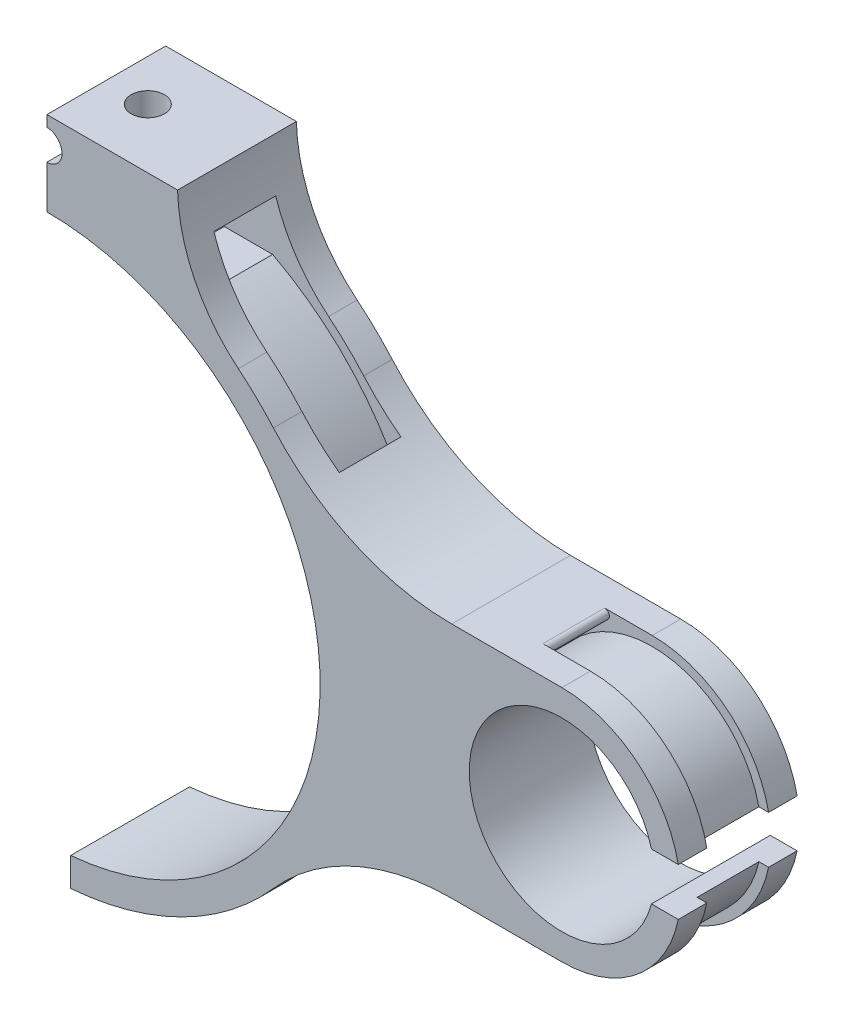
from build123d import *
from build123d.topology import SkipClean

# Parameters (mm, degrees)
SKETCH1_R                        = 63.5
SKETCH1_R_2                      = 57.5
MAIN_SHAPE_DEPTH                 = 12.5
MOTOR_MOUNT_REACH                = 92.668
MOTOR_MOUNT_DIRECTION_2_REACH    = 92.668
HARNESS_START                    = -12.5
HARNESS_DEPTH                    = 25
HARNESS_FILLET_R                 = 35
SKETCH3_R                        = 65.5
SKETCH3_R_2                      = 61.5
MAIN_SLOT_DEPTH                  = 6.5
SKETCH8_R                        = 19.5
MOTOR_CUT_DEPTH                  = 154.6383962
SKETCH9_R                        = 25
SKETCH9_R_2                      = 23
MOTOR_SLOT_DEPTH                 = 6.5
MOTOR_MOUNT_FILLET_R             = 50
SKETCH17_W                       = 6.80384635
SKETCH17_H                       = 10
MOTOR_KEYWAY_DEPTH               = 156.156394606
MOTOR_MOUNT_FILLET_OF_MIRROR_2_R = 50
BOLT_HOLES_REACH                 = 194.503
BOLT_HOLES_END_RADIUS            = 65.5
SKETCH13_R                       = 3.5
SKETCH15_W                       = 10
SKETCH15_H                       = 25
MAIN_KEYWAY_DEPTH                = 154.200127936
HARNESS_CUT_DEPTH                = 154.200127936
HARNESS_CUT_DEPTH_BACK           = 154.200127936
SKETCH19_W                       = 13
SKETCH19_H                       = 11
SKETCH22_R                       = 3.175
CUT_EXTRUDE1_DEPTH               = 155.72242625
FILLET1_START                    = -6.5
FILLET1_DEPTH                    = 13
SKETCH18_W                       = 87.910822745
SKETCH18_H                       = 167.162250969
SPLIT_FOR_PRINTING_DEPTH         = 154.200127887


with BuildPart() as part:
    # Sketch1 → main shape (new, symmetric)
    with BuildSketch(Plane.XY):
        Circle(SKETCH1_R)
        Circle(SKETCH1_R_2, mode=Mode.SUBTRACT)
    extrude(amount=MAIN_SHAPE_DEPTH, both=True)

    # motor mount: up to this face of the body (flat: up to its plane)
    motor_mount_end = Plane(part.part.faces().sort_by_distance((-61.703948776, 0, 12.5))[0])
    # Sketch6 → motor mount (add, up to the picked face)
    with BuildSketch(Plane.XY, mode=Mode.PRIVATE) as motor_mount_sk1:
        with BuildLine():
            Line((-58.37165408, 25), (-108.37165408, 25))
            ThreePointArc((-108.37165408, 25), (-133.37165408, 0), (-108.37165408, -25))
            Line((-108.37165408, -25), (-58.37165408, -25))
            ThreePointArc((-58.37165408, -25), (-63.5, 0), (-58.37165408, 25))
        make_face()
    motor_mount_tool1 = split(extrude(motor_mount_sk1.sketch, amount=MOTOR_MOUNT_REACH, mode=Mode.PRIVATE), bisect_by=motor_mount_end, keep=Keep.BOTH, mode=Mode.PRIVATE)
    motor_mount = motor_mount_tool1.solids().sort_by(Axis((-95.130644, 0, 0), (0, 0, 1)))[0]
    add(motor_mount)

    # motor mount direction 2: up to this face of the body (flat: up to its plane)
    motor_mount_direction_2_end = Plane(part.part.faces().sort_by_distance((-61.703948776, 0, -12.5))[0])
    # Sketch6 → motor mount direction 2 (add, up to the picked face)
    with BuildSketch(Plane.XY, mode=Mode.PRIVATE) as motor_mount_direction_2_sk1:
        with BuildLine():
            Line((-58.37165408, 25), (-108.37165408, 25))
            ThreePointArc((-108.37165408, 25), (-133.37165408, 0), (-108.37165408, -25))
            Line((-108.37165408, -25), (-58.37165408, -25))
            ThreePointArc((-58.37165408, -25), (-63.5, 0), (-58.37165408, 25))
        make_face()
    motor_mount_direction_2_tool1 = split(extrude(motor_mount_direction_2_sk1.sketch, amount=-MOTOR_MOUNT_DIRECTION_2_REACH, mode=Mode.PRIVATE), bisect_by=motor_mount_direction_2_end, keep=Keep.BOTH, mode=Mode.PRIVATE)
    motor_mount_direction_2 = motor_mount_direction_2_tool1.solids().sort_by(Axis((-95.130644, 0, 0), (0, 0, -1)))[0]
    add(motor_mount_direction_2)

    # Sketch11 → harness (add)
    with BuildSketch(Plane.XY.offset(HARNESS_START)):
        with BuildLine():
            Line((27.5, 75.236352085), (27.5, 57.236352085))
            ThreePointArc((27.5, 57.236352085), (0, 63.5), (-27.5, 57.236352085))
            Line((-27.5, 57.236352085), (-27.5, 75.236352085))
            Line((-27.5, 75.236352085), (27.5, 75.236352085))
        make_face()
    extrude(amount=HARNESS_DEPTH)

    # harness fillet
    # the kernel refuses this fillet: 35 mm, written as the material it adds along each edge
    with BuildSketch(Plane(origin=(27.5, 57.236352085, -12.5), x_dir=(0.8432130840370694, -0.5375794777599814, 0), z_dir=(0, 0, 1))) as harness_fillet_piece_1:
        with BuildLine():
            CenterArc((19.339811168, 34.749695763), HARNESS_FILLET_R, 214.0002145, 49.143374048)
            Line((-9.6764306, 15.177835513), (-10.256755435, 14.786398308))
            ThreePointArc((-10.256755435, 14.786398308), (-5.428464459, 7.212612122), (-0.590249159, -0.376305634))
            Line((-0.590249159, -0.376305634), (0.083567085, -0.694993915))
            ThreePointArc((0.083567085, -0.694993915), (7.580728452, -0.245876599), (15.077889818, -0.694993915))
            Line((15.077889818, -0.694993915), (15.161456903, 0))
        make_face()
    extrude(amount=25)
    with BuildSketch(Plane(origin=(-27.5, 57.236352085, -12.5), x_dir=(-0.8432130840370696, -0.5375794777599807, 0), z_dir=(0, 0, 1))) as harness_fillet_piece_2:
        with BuildLine():
            CenterArc((19.339811168, -34.749695763), HARNESS_FILLET_R, 96.856411452, 49.143374048)
            Line((-9.6764306, -15.177835513), (-10.256755435, -14.786398308))
            ThreePointArc((-10.256755435, -14.786398308), (-5.428464459, -7.212612122), (-0.590249159, 0.376305634))
            Line((-0.590249159, 0.376305634), (0.083567085, 0.694993915))
            ThreePointArc((0.083567085, 0.694993915), (7.580728452, 0.245876599), (15.077889818, 0.694993915))
            Line((15.077889818, 0.694993915), (15.161456903, 0))
        make_face()
    extrude(amount=25)

    # Sketch3 → main slot (cut, symmetric)
    with BuildSketch(Plane.XY):
        Circle(SKETCH3_R)
        Circle(SKETCH3_R_2, mode=Mode.SUBTRACT)
    main_slot = extrude(amount=MAIN_SLOT_DEPTH, both=True, mode=Mode.SUBTRACT)

    # Sketch8 → motor cut (cut, symmetric)
    with BuildSketch(Plane.XY):
        with Locations((-108.37165408, 0)):
            Circle(SKETCH8_R)
    motor_cut = extrude(amount=MOTOR_CUT_DEPTH, both=True, mode=Mode.SUBTRACT)

    # Sketch9 → motor slot (cut, symmetric)
    with BuildSketch(Plane.XY):
        with Locations((-108.37165408, 0)):
            Circle(SKETCH9_R)
        with Locations((-108.37165408, 0)):
            Circle(SKETCH9_R_2, mode=Mode.SUBTRACT)
    motor_slot = extrude(amount=MOTOR_SLOT_DEPTH, both=True, mode=Mode.SUBTRACT)

    # motor mount fillet
    # the kernel refuses this fillet: 50 mm, written as the material it adds along each edge
    with BuildSketch(Plane(origin=(-58.37165408, 25, -12.5), x_dir=(0.5339491439674308, 0.845516594548237, 0), z_dir=(0, 0, 1))) as motor_mount_fillet_piece_1_section:
        with BuildLine():
            CenterArc((27.956466708, 49.372386437), MOTOR_MOUNT_FILLET_R, 212.272672979, 48.639624147)
            Line((-14.31936302, 22.674929238), (0, 0))
            ThreePointArc((0, 0), (10.029579864, 0.797069225), (20.059159728, 0))
        make_face()
    motor_mount_fillet_piece_1 = extrude(amount=6, mode=Mode.PRIVATE)
    motor_mount_fillet_piece_1 = motor_mount_fillet_piece_1 & Plane(origin=(0, 0, -12.5), x_dir=(1, 0, 0), z_dir=(0, 0, 1)) * Cylinder(65.5, 103, mode=Mode.PRIVATE)
    add(motor_mount_fillet_piece_1)
    with BuildSketch(Plane(origin=(-58.37165408, 25, -12.5), x_dir=(0.5339491439674308, 0.845516594548237, 0), z_dir=(0, 0, 1))) as motor_mount_fillet_piece_2_section:
        with BuildLine():
            CenterArc((27.956466708, 49.372386437), MOTOR_MOUNT_FILLET_R, 212.272672979, 48.639624147)
            Line((-14.31936302, 22.674929238), (0, 0))
            ThreePointArc((0, 0), (10.029579864, 0.797069225), (20.059159728, 0))
        make_face()
    motor_mount_fillet_piece_2 = extrude(amount=6, mode=Mode.PRIVATE)
    motor_mount_fillet_piece_2 = motor_mount_fillet_piece_2 - Plane(origin=(0, 0, -12.5), x_dir=(1, 0, 0), z_dir=(0, 0, 1)) * Cylinder(65.5, 103, mode=Mode.PRIVATE)
    add(motor_mount_fillet_piece_2)
    with BuildSketch(Plane(origin=(-58.37165408, 25, -12.5), x_dir=(0.5339491439674308, 0.845516594548237, 0), z_dir=(0, 0, 1))) as motor_mount_fillet_piece_3_section:
        with BuildLine():
            CenterArc((27.956466708, 49.372386437), MOTOR_MOUNT_FILLET_R, 212.272672979, 48.639624147)
            Line((-14.31936302, 22.674929238), (0, 0))
            ThreePointArc((0, 0), (10.029579864, 0.797069225), (20.059159728, 0))
        make_face()
    motor_mount_fillet_piece_3 = extrude(amount=73.044601445, mode=Mode.PRIVATE)
    motor_mount_fillet_piece_3 = split(motor_mount_fillet_piece_3, bisect_by=Plane(origin=(-58.37165408, 25, -6.5), z_dir=(0, 0, 1)), keep=Keep.TOP, mode=Mode.PRIVATE)
    motor_mount_fillet_piece_3 = split(motor_mount_fillet_piece_3, bisect_by=Plane(origin=(-58.37165408, 25, 6.5), z_dir=(0, 0, -1)), keep=Keep.TOP, mode=Mode.PRIVATE)
    motor_mount_fillet_piece_3 = motor_mount_fillet_piece_3 - Plane(origin=(0, 0, -12.5), x_dir=(1, 0, 0), z_dir=(0, 0, 1)) * Cylinder(65.5, 237, mode=Mode.PRIVATE)
    add(motor_mount_fillet_piece_3)
    with BuildSketch(Plane(origin=(-58.37165408, 25, -12.5), x_dir=(0.5339491439674308, 0.845516594548237, 0), z_dir=(0, 0, 1))) as motor_mount_fillet_piece_4_section:
        with BuildLine():
            CenterArc((27.956466708, 49.372386437), MOTOR_MOUNT_FILLET_R, 212.272672979, 48.639624147)
            Line((-14.31936302, 22.674929238), (0, 0))
            ThreePointArc((0, 0), (10.029579864, 0.797069225), (20.059159728, 0))
        make_face()
    motor_mount_fillet_piece_4 = extrude(amount=73.044601445, mode=Mode.PRIVATE)
    motor_mount_fillet_piece_4 = split(motor_mount_fillet_piece_4, bisect_by=Plane(origin=(-58.37165408, 25, 12.5), z_dir=(0, 0, -1)), keep=Keep.TOP, mode=Mode.PRIVATE)
    motor_mount_fillet_piece_4 = split(motor_mount_fillet_piece_4, bisect_by=Plane(origin=(-58.37165408, 25, 6.5), z_dir=(0, 0, 1)), keep=Keep.TOP, mode=Mode.PRIVATE)
    motor_mount_fillet_piece_4 = motor_mount_fillet_piece_4 & Plane(origin=(0, 0, -12.5), x_dir=(1, 0, 0), z_dir=(0, 0, 1)) * Cylinder(65.5, 237, mode=Mode.PRIVATE)
    add(motor_mount_fillet_piece_4)
    with BuildSketch(Plane(origin=(-58.37165408, 25, -12.5), x_dir=(0.5339491439674308, 0.845516594548237, 0), z_dir=(0, 0, 1))) as motor_mount_fillet_piece_5_section:
        with BuildLine():
            CenterArc((27.956466708, 49.372386437), MOTOR_MOUNT_FILLET_R, 212.272672979, 48.639624147)
            Line((-14.31936302, 22.674929238), (0, 0))
            ThreePointArc((0, 0), (10.029579864, 0.797069225), (20.059159728, 0))
        make_face()
    motor_mount_fillet_piece_5 = extrude(amount=73.044601445, mode=Mode.PRIVATE)
    motor_mount_fillet_piece_5 = split(motor_mount_fillet_piece_5, bisect_by=Plane(origin=(-58.37165408, 25, 12.5), z_dir=(0, 0, -1)), keep=Keep.TOP, mode=Mode.PRIVATE)
    motor_mount_fillet_piece_5 = split(motor_mount_fillet_piece_5, bisect_by=Plane(origin=(-58.37165408, 25, 6.5), z_dir=(0, 0, 1)), keep=Keep.TOP, mode=Mode.PRIVATE)
    motor_mount_fillet_piece_5 = motor_mount_fillet_piece_5 - Plane(origin=(0, 0, -12.5), x_dir=(1, 0, 0), z_dir=(0, 0, 1)) * Cylinder(65.5, 237, mode=Mode.PRIVATE)
    add(motor_mount_fillet_piece_5)
    with BuildSketch(Plane(origin=(-58.37165408, -25, 12.5), x_dir=(-1, 0, 0), z_dir=(0, 0, -1))) as motor_mount_fillet_piece_6_section:
        with BuildLine():
            CenterArc((26.817840578, -50), MOTOR_MOUNT_FILLET_R, 90, 48.639624147)
            ThreePointArc((-10.710571166, -16.960352423), (-4.681350326, -8.905770642), (0, 0))
            Line((0, 0), (26.817840578, 0))
        make_face()
    motor_mount_fillet_piece_6 = extrude(amount=6, mode=Mode.PRIVATE)
    motor_mount_fillet_piece_6 = motor_mount_fillet_piece_6 - Plane(origin=(0, 0, 12.5), x_dir=(1, 0, 0), z_dir=(0, 0, 1)) * Cylinder(65.5, 120, mode=Mode.PRIVATE)
    add(motor_mount_fillet_piece_6)
    with BuildSketch(Plane(origin=(-58.37165408, -25, 12.5), x_dir=(-1, 0, 0), z_dir=(0, 0, -1))) as motor_mount_fillet_piece_7_section:
        with BuildLine():
            CenterArc((26.817840578, -50), MOTOR_MOUNT_FILLET_R, 90, 48.639624147)
            ThreePointArc((-10.710571166, -16.960352423), (-4.681350326, -8.905770642), (0, 0))
            Line((0, 0), (26.817840578, 0))
        make_face()
    motor_mount_fillet_piece_7 = extrude(amount=6, mode=Mode.PRIVATE)
    motor_mount_fillet_piece_7 = motor_mount_fillet_piece_7 & Plane(origin=(0, 0, 12.5), x_dir=(1, 0, 0), z_dir=(0, 0, 1)) * Cylinder(65.5, 120, mode=Mode.PRIVATE)
    add(motor_mount_fillet_piece_7)
    with BuildSketch(Plane(origin=(-58.37165408, -25, 12.5), x_dir=(-1, 0, 0), z_dir=(0, 0, -1))) as motor_mount_fillet_piece_8_section:
        with BuildLine():
            CenterArc((26.817840578, -50), MOTOR_MOUNT_FILLET_R, 90, 48.639624147)
            ThreePointArc((-10.710571166, -16.960352423), (-4.681350326, -8.905770642), (0, 0))
            Line((0, 0), (26.817840578, 0))
        make_face()
    motor_mount_fillet_piece_8 = extrude(amount=73.044601445, mode=Mode.PRIVATE)
    motor_mount_fillet_piece_8 = split(motor_mount_fillet_piece_8, bisect_by=Plane(origin=(-58.37165408, -25, 6.5), z_dir=(0, 0, -1)), keep=Keep.TOP, mode=Mode.PRIVATE)
    motor_mount_fillet_piece_8 = motor_mount_fillet_piece_8 - Plane(origin=(0, 0, 12.5), x_dir=(1, 0, 0), z_dir=(0, 0, 1)) * Cylinder(65.5, 254, mode=Mode.PRIVATE)
    motor_mount_fillet_piece_8 = split(motor_mount_fillet_piece_8, bisect_by=Plane(origin=(-58.37165408, -25, -6.5), z_dir=(0, 0, 1)), keep=Keep.TOP, mode=Mode.PRIVATE)
    add(motor_mount_fillet_piece_8)
    with BuildSketch(Plane(origin=(-58.37165408, -25, 12.5), x_dir=(-1, 0, 0), z_dir=(0, 0, -1))) as motor_mount_fillet_piece_9_section:
        with BuildLine():
            CenterArc((26.817840578, -50), MOTOR_MOUNT_FILLET_R, 90, 48.639624147)
            ThreePointArc((-10.710571166, -16.960352423), (-4.681350326, -8.905770642), (0, 0))
            Line((0, 0), (26.817840578, 0))
        make_face()
    motor_mount_fillet_piece_9 = extrude(amount=73.044601445, mode=Mode.PRIVATE)
    motor_mount_fillet_piece_9 = motor_mount_fillet_piece_9 - Plane(origin=(0, 0, 12.5), x_dir=(1, 0, 0), z_dir=(0, 0, 1)) * Cylinder(65.5, 254, mode=Mode.PRIVATE)
    motor_mount_fillet_piece_9 = split(motor_mount_fillet_piece_9, bisect_by=Plane(origin=(-58.37165408, -25, -6.5), z_dir=(0, 0, -1)), keep=Keep.TOP, mode=Mode.PRIVATE)
    motor_mount_fillet_piece_9 = split(motor_mount_fillet_piece_9, bisect_by=Plane(origin=(-58.37165408, -25, -12.5), z_dir=(0, 0, 1)), keep=Keep.TOP, mode=Mode.PRIVATE)
    add(motor_mount_fillet_piece_9)
    with BuildSketch(Plane(origin=(-58.37165408, -25, 12.5), x_dir=(-1, 0, 0), z_dir=(0, 0, -1))) as motor_mount_fillet_piece_10_section:
        with BuildLine():
            CenterArc((26.817840578, -50), MOTOR_MOUNT_FILLET_R, 90, 48.639624147)
            ThreePointArc((-10.710571166, -16.960352423), (-4.681350326, -8.905770642), (0, 0))
            Line((0, 0), (26.817840578, 0))
        make_face()
    motor_mount_fillet_piece_10 = extrude(amount=73.044601445, mode=Mode.PRIVATE)
    motor_mount_fillet_piece_10 = motor_mount_fillet_piece_10 & Plane(origin=(0, 0, 12.5), x_dir=(1, 0, 0), z_dir=(0, 0, 1)) * Cylinder(65.5, 254, mode=Mode.PRIVATE)
    motor_mount_fillet_piece_10 = split(motor_mount_fillet_piece_10, bisect_by=Plane(origin=(-58.37165408, -25, -6.5), z_dir=(0, 0, -1)), keep=Keep.TOP, mode=Mode.PRIVATE)
    motor_mount_fillet_piece_10 = split(motor_mount_fillet_piece_10, bisect_by=Plane(origin=(-58.37165408, -25, -12.5), z_dir=(0, 0, 1)), keep=Keep.TOP, mode=Mode.PRIVATE)
    add(motor_mount_fillet_piece_10)

    # Sketch17 → motor keyway (cut, through all)
    with BuildSketch(Plane(origin=(0, 0, -12.5), x_dir=(-1, 0, 0), z_dir=(0, 0, -1))):
        with Locations((130.62165408, 0)):
            Rectangle(SKETCH17_W, SKETCH17_H)
    motor_keyway = extrude(amount=-MOTOR_KEYWAY_DEPTH, mode=Mode.SUBTRACT)

    # Mirror 2: motor mount, motor mount direction 2, main slot, motor cut, motor slot, motor keyway across plane
    with SkipClean():  # the faces are left unmerged after this step: merging them gives an invalid solid
        add(motor_mount.mirror(Plane(origin=(0, 0, 0), x_dir=(0, 0, 1), z_dir=(1, 0, 0))))
        add(motor_mount_direction_2.mirror(Plane(origin=(0, 0, 0), x_dir=(0, 0, 1), z_dir=(1, 0, 0))))
        add(main_slot.mirror(Plane(origin=(0, 0, 0), x_dir=(0, 0, 1), z_dir=(1, 0, 0))), mode=Mode.SUBTRACT)
        add(motor_cut.mirror(Plane(origin=(0, 0, 0), x_dir=(0, 0, 1), z_dir=(1, 0, 0))), mode=Mode.SUBTRACT)
        add(motor_slot.mirror(Plane(origin=(0, 0, 0), x_dir=(0, 0, 1), z_dir=(1, 0, 0))), mode=Mode.SUBTRACT)
        add(motor_keyway.mirror(Plane(origin=(0, 0, 0), x_dir=(0, 0, 1), z_dir=(1, 0, 0))), mode=Mode.SUBTRACT)

    # motor mount fillet of Mirror 2
    # the kernel refuses this fillet: 50 mm, written as the material it adds along each edge
    with BuildSketch(Plane(origin=(58.37165408, 25, 60.544601445), x_dir=(-0.5339491439674316, 0.8455165945482365, 0), z_dir=(0, 0, -1))) as motor_mount_fillet_of_mirror_2_piece_1_section:
        with BuildLine():
            CenterArc((27.956466708, 49.372386437), MOTOR_MOUNT_FILLET_OF_MIRROR_2_R, 212.272672979, 48.639624147)
            Line((-14.31936302, 22.674929238), (0, 0))
            ThreePointArc((0, 0), (10.029579864, 0.797069225), (20.059159728, 0))
        make_face()
    motor_mount_fillet_of_mirror_2_piece_1 = extrude(amount=73.044601445, mode=Mode.PRIVATE)
    motor_mount_fillet_of_mirror_2_piece_1 = split(motor_mount_fillet_of_mirror_2_piece_1, bisect_by=Plane(origin=(58.37165408, 25, 12.5), z_dir=(0, 0, -1)), keep=Keep.TOP, mode=Mode.PRIVATE)
    motor_mount_fillet_of_mirror_2_piece_1 = split(motor_mount_fillet_of_mirror_2_piece_1, bisect_by=Plane(origin=(58.37165408, 25, 6.5), z_dir=(0, 0, 1)), keep=Keep.TOP, mode=Mode.PRIVATE)
    motor_mount_fillet_of_mirror_2_piece_1 = motor_mount_fillet_of_mirror_2_piece_1 & Plane(origin=(0, 0, 60.544601445), x_dir=(-1, 0, 0), z_dir=(0, 0, 1)) * Cylinder(65.5, 237, mode=Mode.PRIVATE)
    add(motor_mount_fillet_of_mirror_2_piece_1)
    with BuildSketch(Plane(origin=(58.37165408, 25, 60.544601445), x_dir=(-0.5339491439674316, 0.8455165945482365, 0), z_dir=(0, 0, -1))) as motor_mount_fillet_of_mirror_2_piece_2_section:
        with BuildLine():
            CenterArc((27.956466708, 49.372386437), MOTOR_MOUNT_FILLET_OF_MIRROR_2_R, 212.272672979, 48.639624147)
            Line((-14.31936302, 22.674929238), (0, 0))
            ThreePointArc((0, 0), (10.029579864, 0.797069225), (20.059159728, 0))
        make_face()
    motor_mount_fillet_of_mirror_2_piece_2 = extrude(amount=73.044601445, mode=Mode.PRIVATE)
    motor_mount_fillet_of_mirror_2_piece_2 = split(motor_mount_fillet_of_mirror_2_piece_2, bisect_by=Plane(origin=(58.37165408, 25, 12.5), z_dir=(0, 0, -1)), keep=Keep.TOP, mode=Mode.PRIVATE)
    motor_mount_fillet_of_mirror_2_piece_2 = split(motor_mount_fillet_of_mirror_2_piece_2, bisect_by=Plane(origin=(58.37165408, 25, 6.5), z_dir=(0, 0, 1)), keep=Keep.TOP, mode=Mode.PRIVATE)
    motor_mount_fillet_of_mirror_2_piece_2 = motor_mount_fillet_of_mirror_2_piece_2 - Plane(origin=(0, 0, 60.544601445), x_dir=(-1, 0, 0), z_dir=(0, 0, 1)) * Cylinder(65.5, 237, mode=Mode.PRIVATE)
    add(motor_mount_fillet_of_mirror_2_piece_2)
    with BuildSketch(Plane(origin=(58.37165408, 25, 60.544601445), x_dir=(-0.5339491439674316, 0.8455165945482365, 0), z_dir=(0, 0, -1))) as motor_mount_fillet_of_mirror_2_piece_3_section:
        with BuildLine():
            CenterArc((27.956466708, 49.372386437), MOTOR_MOUNT_FILLET_OF_MIRROR_2_R, 212.272672979, 48.639624147)
            Line((-14.31936302, 22.674929238), (0, 0))
            ThreePointArc((0, 0), (10.029579864, 0.797069225), (20.059159728, 0))
        make_face()
    motor_mount_fillet_of_mirror_2_piece_3 = extrude(amount=73.044601445, mode=Mode.PRIVATE)
    motor_mount_fillet_of_mirror_2_piece_3 = split(motor_mount_fillet_of_mirror_2_piece_3, bisect_by=Plane(origin=(58.37165408, 25, 6.5), z_dir=(0, 0, -1)), keep=Keep.TOP, mode=Mode.PRIVATE)
    motor_mount_fillet_of_mirror_2_piece_3 = split(motor_mount_fillet_of_mirror_2_piece_3, bisect_by=Plane(origin=(58.37165408, 25, -6.5), z_dir=(0, 0, 1)), keep=Keep.TOP, mode=Mode.PRIVATE)
    motor_mount_fillet_of_mirror_2_piece_3 = motor_mount_fillet_of_mirror_2_piece_3 - Plane(origin=(0, 0, 60.544601445), x_dir=(-1, 0, 0), z_dir=(0, 0, 1)) * Cylinder(65.5, 237, mode=Mode.PRIVATE)
    add(motor_mount_fillet_of_mirror_2_piece_3)
    with BuildSketch(Plane(origin=(58.37165408, 25, -6.5), x_dir=(-0.5339491439674316, 0.8455165945482365, 0), z_dir=(0, 0, -1))) as motor_mount_fillet_of_mirror_2_piece_4_section:
        with BuildLine():
            CenterArc((27.956466708, 49.372386437), MOTOR_MOUNT_FILLET_OF_MIRROR_2_R, 212.272672979, 48.639624147)
            Line((-14.31936302, 22.674929238), (0, 0))
            ThreePointArc((0, 0), (10.029579864, 0.797069225), (20.059159728, 0))
        make_face()
    motor_mount_fillet_of_mirror_2_piece_4 = extrude(amount=6, mode=Mode.PRIVATE)
    motor_mount_fillet_of_mirror_2_piece_4 = motor_mount_fillet_of_mirror_2_piece_4 & Plane(origin=(0, 0, -6.5), x_dir=(-1, 0, 0), z_dir=(0, 0, 1)) * Cylinder(65.5, 103, mode=Mode.PRIVATE)
    add(motor_mount_fillet_of_mirror_2_piece_4)
    with BuildSketch(Plane(origin=(58.37165408, 25, -6.5), x_dir=(-0.5339491439674316, 0.8455165945482365, 0), z_dir=(0, 0, -1))) as motor_mount_fillet_of_mirror_2_piece_5_section:
        with BuildLine():
            CenterArc((27.956466708, 49.372386437), MOTOR_MOUNT_FILLET_OF_MIRROR_2_R, 212.272672979, 48.639624147)
            Line((-14.31936302, 22.674929238), (0, 0))
            ThreePointArc((0, 0), (10.029579864, 0.797069225), (20.059159728, 0))
        make_face()
    motor_mount_fillet_of_mirror_2_piece_5 = extrude(amount=6, mode=Mode.PRIVATE)
    motor_mount_fillet_of_mirror_2_piece_5 = motor_mount_fillet_of_mirror_2_piece_5 - Plane(origin=(0, 0, -6.5), x_dir=(-1, 0, 0), z_dir=(0, 0, 1)) * Cylinder(65.5, 103, mode=Mode.PRIVATE)
    add(motor_mount_fillet_of_mirror_2_piece_5)
    with BuildSketch(Plane(origin=(58.37165408, -25, -60.544601445), x_dir=(1, 0, 0), z_dir=(0, 0, 1))) as motor_mount_fillet_of_mirror_2_piece_6_section:
        with BuildLine():
            CenterArc((26.817840578, -50), MOTOR_MOUNT_FILLET_OF_MIRROR_2_R, 90, 48.639624147)
            ThreePointArc((-10.710571166, -16.960352423), (-4.681350326, -8.905770642), (0, 0))
            Line((0, 0), (26.817840578, 0))
        make_face()
    motor_mount_fillet_of_mirror_2_piece_6 = extrude(amount=73.044601445, mode=Mode.PRIVATE)
    motor_mount_fillet_of_mirror_2_piece_6 = split(motor_mount_fillet_of_mirror_2_piece_6, bisect_by=Plane(origin=(58.37165408, -25, -12.5), z_dir=(0, 0, 1)), keep=Keep.TOP, mode=Mode.PRIVATE)
    motor_mount_fillet_of_mirror_2_piece_6 = motor_mount_fillet_of_mirror_2_piece_6 - Plane(origin=(0, 0, -60.544601445), x_dir=(-1, 0, 0), z_dir=(0, 0, 1)) * Cylinder(65.5, 254, mode=Mode.PRIVATE)
    motor_mount_fillet_of_mirror_2_piece_6 = split(motor_mount_fillet_of_mirror_2_piece_6, bisect_by=Plane(origin=(58.37165408, -25, -6.5), z_dir=(0, 0, -1)), keep=Keep.TOP, mode=Mode.PRIVATE)
    add(motor_mount_fillet_of_mirror_2_piece_6)
    with BuildSketch(Plane(origin=(58.37165408, -25, -60.544601445), x_dir=(1, 0, 0), z_dir=(0, 0, 1))) as motor_mount_fillet_of_mirror_2_piece_7_section:
        with BuildLine():
            CenterArc((26.817840578, -50), MOTOR_MOUNT_FILLET_OF_MIRROR_2_R, 90, 48.639624147)
            ThreePointArc((-10.710571166, -16.960352423), (-4.681350326, -8.905770642), (0, 0))
            Line((0, 0), (26.817840578, 0))
        make_face()
    motor_mount_fillet_of_mirror_2_piece_7 = extrude(amount=73.044601445, mode=Mode.PRIVATE)
    motor_mount_fillet_of_mirror_2_piece_7 = split(motor_mount_fillet_of_mirror_2_piece_7, bisect_by=Plane(origin=(58.37165408, -25, -12.5), z_dir=(0, 0, 1)), keep=Keep.TOP, mode=Mode.PRIVATE)
    motor_mount_fillet_of_mirror_2_piece_7 = motor_mount_fillet_of_mirror_2_piece_7 & Plane(origin=(0, 0, -60.544601445), x_dir=(-1, 0, 0), z_dir=(0, 0, 1)) * Cylinder(65.5, 254, mode=Mode.PRIVATE)
    motor_mount_fillet_of_mirror_2_piece_7 = split(motor_mount_fillet_of_mirror_2_piece_7, bisect_by=Plane(origin=(58.37165408, -25, -6.5), z_dir=(0, 0, -1)), keep=Keep.TOP, mode=Mode.PRIVATE)
    add(motor_mount_fillet_of_mirror_2_piece_7)
    with BuildSketch(Plane(origin=(58.37165408, -25, -60.544601445), x_dir=(1, 0, 0), z_dir=(0, 0, 1))) as motor_mount_fillet_of_mirror_2_piece_8_section:
        with BuildLine():
            CenterArc((26.817840578, -50), MOTOR_MOUNT_FILLET_OF_MIRROR_2_R, 90, 48.639624147)
            ThreePointArc((-10.710571166, -16.960352423), (-4.681350326, -8.905770642), (0, 0))
            Line((0, 0), (26.817840578, 0))
        make_face()
    motor_mount_fillet_of_mirror_2_piece_8 = extrude(amount=73.044601445, mode=Mode.PRIVATE)
    motor_mount_fillet_of_mirror_2_piece_8 = motor_mount_fillet_of_mirror_2_piece_8 - Plane(origin=(0, 0, -60.544601445), x_dir=(-1, 0, 0), z_dir=(0, 0, 1)) * Cylinder(65.5, 254, mode=Mode.PRIVATE)
    motor_mount_fillet_of_mirror_2_piece_8 = split(motor_mount_fillet_of_mirror_2_piece_8, bisect_by=Plane(origin=(58.37165408, -25, 6.5), z_dir=(0, 0, -1)), keep=Keep.TOP, mode=Mode.PRIVATE)
    motor_mount_fillet_of_mirror_2_piece_8 = split(motor_mount_fillet_of_mirror_2_piece_8, bisect_by=Plane(origin=(58.37165408, -25, -6.5), z_dir=(0, 0, 1)), keep=Keep.TOP, mode=Mode.PRIVATE)
    add(motor_mount_fillet_of_mirror_2_piece_8)
    with BuildSketch(Plane(origin=(58.37165408, -25, 6.5), x_dir=(1, 0, 0), z_dir=(0, 0, 1))) as motor_mount_fillet_of_mirror_2_piece_9_section:
        with BuildLine():
            CenterArc((26.817840578, -50), MOTOR_MOUNT_FILLET_OF_MIRROR_2_R, 90, 48.639624147)
            ThreePointArc((-10.710571166, -16.960352423), (-4.681350326, -8.905770642), (0, 0))
            Line((0, 0), (26.817840578, 0))
        make_face()
    motor_mount_fillet_of_mirror_2_piece_9 = extrude(amount=6, mode=Mode.PRIVATE)
    motor_mount_fillet_of_mirror_2_piece_9 = motor_mount_fillet_of_mirror_2_piece_9 - Plane(origin=(0, 0, 6.5), x_dir=(-1, 0, 0), z_dir=(0, 0, 1)) * Cylinder(65.5, 120, mode=Mode.PRIVATE)
    add(motor_mount_fillet_of_mirror_2_piece_9)
    with BuildSketch(Plane(origin=(58.37165408, -25, 6.5), x_dir=(1, 0, 0), z_dir=(0, 0, 1))) as motor_mount_fillet_of_mirror_2_piece_10_section:
        with BuildLine():
            CenterArc((26.817840578, -50), MOTOR_MOUNT_FILLET_OF_MIRROR_2_R, 90, 48.639624147)
            ThreePointArc((-10.710571166, -16.960352423), (-4.681350326, -8.905770642), (0, 0))
            Line((0, 0), (26.817840578, 0))
        make_face()
    motor_mount_fillet_of_mirror_2_piece_10 = extrude(amount=6, mode=Mode.PRIVATE)
    motor_mount_fillet_of_mirror_2_piece_10 = motor_mount_fillet_of_mirror_2_piece_10 & Plane(origin=(0, 0, 6.5), x_dir=(-1, 0, 0), z_dir=(0, 0, 1)) * Cylinder(65.5, 120, mode=Mode.PRIVATE)
    add(motor_mount_fillet_of_mirror_2_piece_10)

    # bolt holes: up to this cylinder (the profile starts outside it)
    bolt_holes_end = Plane(origin=(0, 0, 0), z_dir=(0, 0, 1)) * Cylinder(BOLT_HOLES_END_RADIUS, 521.006, mode=Mode.PRIVATE)
    # Sketch13 → bolt holes (cut, up to the surface)
    with BuildSketch(Plane(origin=(0, 75.236352085, 0), x_dir=(1, 0, 0), z_dir=(0, 1, 0)), mode=Mode.PRIVATE) as bolt_holes_sk1:
        with Locations(Location((-8.73125, 0, 0), (0, 0, 270))):
            Circle(SKETCH13_R)
    bolt_holes_tool1 = extrude(bolt_holes_sk1.sketch, amount=-BOLT_HOLES_REACH, mode=Mode.PRIVATE) - bolt_holes_end
    add(bolt_holes_tool1.solids().sort_by_distance((-8.73125, 75.236352, 0))[0], mode=Mode.SUBTRACT)
    # Sketch13 → bolt holes (cut, up to the surface)
    with BuildSketch(Plane(origin=(0, 75.236352085, 0), x_dir=(1, 0, 0), z_dir=(0, 1, 0)), mode=Mode.PRIVATE) as bolt_holes_sk2:
        with Locations(Location((8.73125, 0, 0), (0, 0, 270))):
            Circle(SKETCH13_R)
    bolt_holes_tool2 = extrude(bolt_holes_sk2.sketch, amount=-BOLT_HOLES_REACH, mode=Mode.PRIVATE) - bolt_holes_end
    add(bolt_holes_tool2.solids().sort_by_distance((8.73125, 75.236352, 0))[0], mode=Mode.SUBTRACT)

    # Sketch15 → main keyway (cut, through all)
    with BuildSketch(Plane(origin=(0, 0, 0), x_dir=(1, 0, 0), z_dir=(0, 1, 0))):
        Rectangle(SKETCH15_W, SKETCH15_H)
    extrude(amount=-MAIN_KEYWAY_DEPTH, mode=Mode.SUBTRACT)

    # Sketch19 → harness cut (cut, two sides: drawn at the far end of the back side and taken through both)
    with BuildSketch(Plane(origin=(0, 0, 0), x_dir=(0, 0, -1), z_dir=(1, 0, 0)).offset(-HARNESS_CUT_DEPTH_BACK)):
        with Locations((0, 60)):
            Rectangle(SKETCH19_W, SKETCH19_H)
    extrude(amount=HARNESS_CUT_DEPTH + HARNESS_CUT_DEPTH_BACK, mode=Mode.SUBTRACT)

    # Sketch22 → Cut-Extrude1 (cut, through all)
    with BuildSketch(Plane.XY.offset(12.5)):
        with Locations((0, 69.736352085)):
            Circle(SKETCH22_R)
    extrude(amount=-CUT_EXTRUDE1_DEPTH, mode=Mode.SUBTRACT)

    # Fillet1: read off the stored shape, not the designer's step
    # Fillet1 outline → Fillet1 (cut)
    with BuildSketch(Plane.XY.offset(FILLET1_START)):
        with BuildLine():
            ThreePointArc((-59.087777959, 32.353776423), (-57.878619737, 32.227392221), (-57.685055751, 31.02715493))
            ThreePointArc((-57.685055751, 31.02715493), (-56.632563018, 32.909007977), (-55.51870064, 34.755199313))
            ThreePointArc((-55.51870064, 34.755199313), (-57.277401474, 33.516086803), (-59.087777959, 32.353776423))
        make_face()
        with BuildLine():
            ThreePointArc((-55.51870064, -34.755199313), (-56.632563018, -32.909007977), (-57.685055751, -31.02715493))
            ThreePointArc((-57.685055751, -31.02715493), (-57.878619737, -32.227392221), (-59.087777959, -32.353776423))
            ThreePointArc((-59.087777959, -32.353776423), (-57.277401474, -33.516086803), (-55.51870064, -34.755199313))
        make_face()
        with BuildLine():
            ThreePointArc((-98.756269464, 23.076923077), (-99.352234755, 24.196116135), (-98.37165408, 25))
            Line((-98.37165408, 25), (-108.37165408, 25))
            ThreePointArc((-108.37165408, 25), (-103.468750701, 24.514516892), (-98.756269464, 23.076923077))
        make_face()
        with BuildLine():
            Line((-108.37165408, -25), (-98.37165408, -25))
            ThreePointArc((-98.37165408, -25), (-99.352234755, -24.196116135), (-98.756269464, -23.076923077))
            ThreePointArc((-98.756269464, -23.076923077), (-103.468750701, -24.514516892), (-108.37165408, -25))
        make_face()
        with BuildLine():
            ThreePointArc((98.37165408, 25), (99.352234755, 24.196116135), (98.756269464, 23.076923077))
            ThreePointArc((98.756269464, 23.076923077), (103.468750701, 24.514516892), (108.37165408, 25))
            Line((108.37165408, 25), (98.37165408, 25))
        make_face()
        with BuildLine():
            ThreePointArc((98.756269464, -23.076923077), (99.352234755, -24.196116135), (98.37165408, -25))
            Line((98.37165408, -25), (108.37165408, -25))
            ThreePointArc((108.37165408, -25), (103.468750701, -24.514516892), (98.756269464, -23.076923077))
        make_face()
        with BuildLine():
            ThreePointArc((59.087777959, -32.353776423), (57.878619737, -32.227392221), (57.685055751, -31.02715493))
            ThreePointArc((57.685055751, -31.02715493), (56.632563018, -32.909007977), (55.51870064, -34.755199313))
            ThreePointArc((55.51870064, -34.755199313), (57.277401474, -33.516086803), (59.087777959, -32.353776423))
        make_face()
    extrude(amount=FILLET1_DEPTH, mode=Mode.SUBTRACT)

    # Sketch18 → split for printing (cut, through all)
    with BuildSketch(Plane(origin=(0, 0, 0), x_dir=(0, 0, -1), z_dir=(1, 0, 0))):
        with Locations((3.413587171, -1.264778097)):
            Rectangle(SKETCH18_W, SKETCH18_H)
    extrude(amount=-SPLIT_FOR_PRINTING_DEPTH, mode=Mode.SUBTRACT)


solid = part.part
